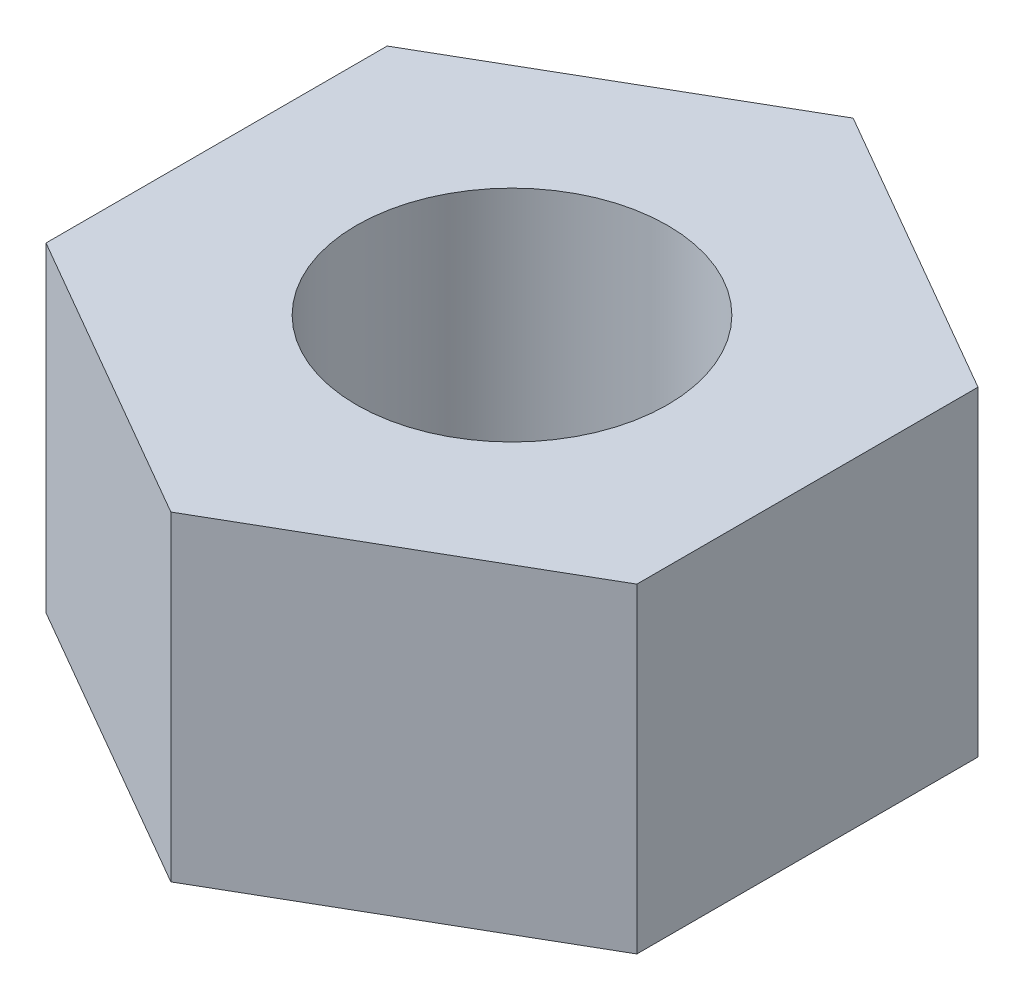
from build123d import *

# Parameters (mm, degrees)
SKETCH1_R           = 1.5
BOSS_EXTRUDE1_DEPTH = 3.09


with BuildPart() as part:
    # Sketch1 → Boss-Extrude1 (new body)
    with BuildSketch(Plane(origin=(0, 0, 0), x_dir=(1, 0, 0), z_dir=(0, 1, 0))):
        Polygon((0, -3.290896534), (2.85, -1.645448267), (2.85, 1.645448267), (0, 3.290896534), (-2.85, 1.645448267), (-2.85, -1.645448267), align=None)
        Circle(SKETCH1_R, mode=Mode.SUBTRACT)
    extrude(amount=BOSS_EXTRUDE1_DEPTH)


solid = part.part
